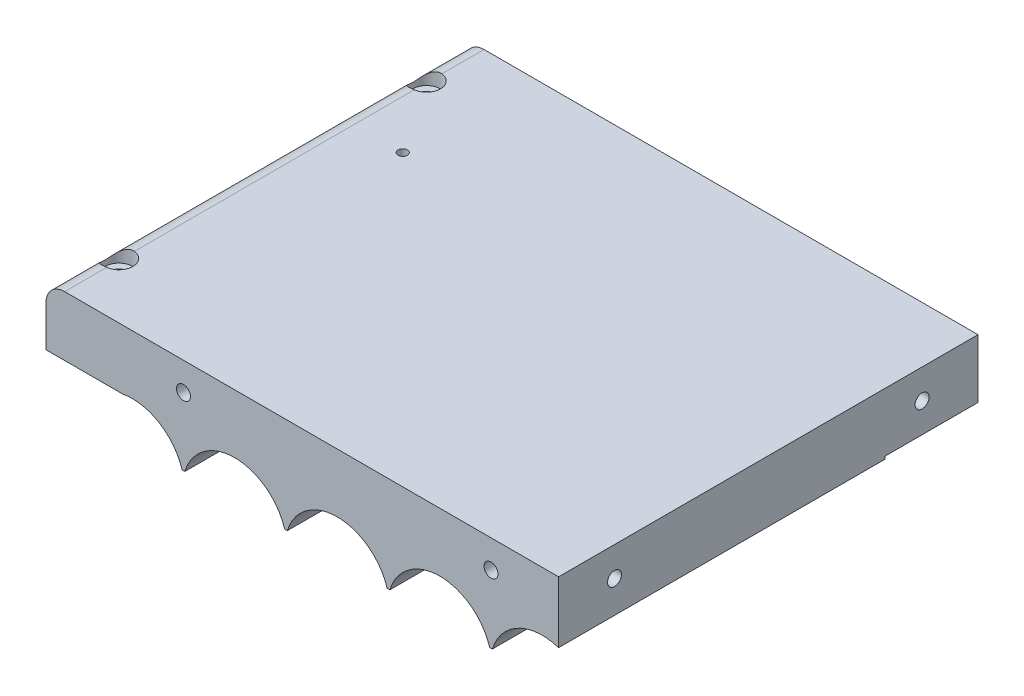
from build123d import *

# Parameters (mm, degrees)
SKETCH_1_W                      = 110
SKETCH_1_H                      = 70
EXTRUDE_1_DEPTH                 = 5
EXTRUDE_2_DEPTH                 = 70
CUT_EXTRUDE_2_DEPTH             = 70
EXTRUDE_3_DEPTH                 = 20
SKETCH_5_R                      = 1.5
CUT_EXTRUDE_3_DEPTH             = 10
SKETCH_6_R                      = 1.5
CUT_EXTRUDE_4_DEPTH             = 10
CUT_EXTRUDE_5_REACH             = 145.602
SKETCH_7_R                      = 1.5
CUT_EXTRUDE_5_DIRECTION_2_DEPTH = 144.601807274
SKETCH_8_R                      = 3
CUT_EXTRUDE_6_DEPTH             = 3
CUT_EXTRUDE_7_REACH             = 145.602
SKETCH_9_R                      = 1
FILLET_1_R                      = 4
SKETCH_10_R                     = 1.5
CUT_EXTRUDE_8_DEPTH             = 10


with BuildPart() as part:
    # 草图1 → 凸台-拉伸1 (new body)
    with BuildSketch(Plane(origin=(0, 0, 0), x_dir=(1, 0, 0), z_dir=(0, 1, 0))):
        with Locations((55, 35)):
            Rectangle(SKETCH_1_W, SKETCH_1_H)
    extrude(amount=EXTRUDE_1_DEPTH)

    # 草图2 → 凸台-拉伸2 (add)
    with BuildSketch(Plane(origin=(0, 0, -70), x_dir=(-1, 0, 0), z_dir=(0, 0, -1))):
        with BuildLine():
            Line((0, 0), (-110, 0))
            Line((-110, 0), (-110, -8.38034143))
            ThreePointArc((-110, -8.38034143), (-101.497088177, -9.012210946), (-96.000017961, -15.529955003))
            Line((-96.000017961, -15.529955003), (-94.999994392, -15.529955003))
            ThreePointArc((-94.999994392, -15.529955003), (-84.5, -7.808692226), (-74.000005608, -15.529955003))
            Line((-74.000005608, -15.529955003), (-72.999994392, -15.529955003))
            ThreePointArc((-72.999994392, -15.529955003), (-62.5, -7.808692226), (-52.000005608, -15.529955003))
            Line((-52.000005608, -15.529955003), (-50.999994392, -15.529955003))
            ThreePointArc((-50.999994392, -15.529955003), (-40.5, -7.808692226), (-30.000005608, -15.529955003))
            Line((-30.000005608, -15.529955003), (-29.000017961, -15.529955003))
            ThreePointArc((-29.000017961, -15.529955003), (-25.01669227, -9.946792076), (-18.500017961, -7.808674266))
            Line((-18.500017961, -7.808674266), (0, -7.808674266))
            Line((0, -7.808674266), (0, 0))
        make_face()
    extrude(amount=-EXTRUDE_2_DEPTH)

    # 草图3 → 切除-拉伸2 (cut)
    with BuildSketch(Plane(origin=(0, 0, -70), x_dir=(-1, 0, 0), z_dir=(0, 0, -1))):
        with BuildLine():
            Line((-96.000017961, -15.529955003), (-95.790676244, -15.529955003))
            ThreePointArc((-95.790676244, -15.529955003), (-101.348565543, -8.863698751), (-110, -8.169589449))
            Line((-110, -8.169589449), (-110, -8.38034143))
            ThreePointArc((-110, -8.38034143), (-101.497088177, -9.012210946), (-96.000017961, -15.529955003))
        make_face()
        with BuildLine():
            ThreePointArc((-73.790676244, -15.529955003), (-84.500017961, -7.608674266), (-95.209359677, -15.529955003))
            Line((-95.209359677, -15.529955003), (-94.999994392, -15.529955003))
            ThreePointArc((-94.999994392, -15.529955003), (-84.5, -7.808692226), (-74.000005608, -15.529955003))
            Line((-74.000005608, -15.529955003), (-73.790676244, -15.529955003))
        make_face()
        with BuildLine():
            ThreePointArc((-51.790676244, -15.529955003), (-62.500017961, -7.608674266), (-73.209359677, -15.529955003))
            Line((-73.209359677, -15.529955003), (-72.999994392, -15.529955003))
            ThreePointArc((-72.999994392, -15.529955003), (-62.5, -7.808692226), (-52.000005608, -15.529955003))
            Line((-52.000005608, -15.529955003), (-51.790676244, -15.529955003))
        make_face()
        with BuildLine():
            ThreePointArc((-29.790676244, -15.529955003), (-40.500017961, -7.608674266), (-51.209359677, -15.529955003))
            Line((-51.209359677, -15.529955003), (-50.999994392, -15.529955003))
            ThreePointArc((-50.999994392, -15.529955003), (-40.5, -7.808692226), (-30.000005608, -15.529955003))
            Line((-30.000005608, -15.529955003), (-29.790676244, -15.529955003))
        make_face()
        with BuildLine():
            Line((-18.500017961, -7.808674266), (-16.39288721, -7.808674266))
            ThreePointArc((-16.39288721, -7.808674266), (-24.279641861, -9.215137505), (-29.209359677, -15.529955003))
            Line((-29.209359677, -15.529955003), (-29.000017961, -15.529955003))
            ThreePointArc((-29.000017961, -15.529955003), (-25.01669227, -9.946792076), (-18.500017961, -7.808674266))
        make_face()
    extrude(amount=-CUT_EXTRUDE_2_DEPTH, mode=Mode.SUBTRACT)

    # 草图4 → 凸台-拉伸3 (add)
    with BuildSketch(Plane(origin=(0, 0, -70), x_dir=(-1, 0, 0), z_dir=(0, 0, -1))):
        Polygon((0, 5), (-110, 5), (-110, -7.608674266), (-7.3, -7.608674266), (-7.3, -7.808674266), (0, -7.808674266), (0, -7.608674266), align=None)
    extrude(amount=EXTRUDE_3_DEPTH)

    # 草图5 → 切除-拉伸3 (cut)
    with BuildSketch(Plane.XY):
        with Locations((95.50000898, -1)):
            Circle(SKETCH_5_R)
        with Locations((29.49999102, -1)):
            Circle(SKETCH_5_R)
    extrude(amount=-CUT_EXTRUDE_3_DEPTH, mode=Mode.SUBTRACT)

    # 草图6 → 切除-拉伸4 (cut)
    with BuildSketch(Plane(origin=(110, 0, 0), x_dir=(0, 0, -1), z_dir=(1, 0, 0))):
        with Locations((78, -1.304337133)):
            Circle(SKETCH_6_R)
        with Locations((12, -1.304337133)):
            Circle(SKETCH_6_R)
    extrude(amount=-CUT_EXTRUDE_4_DEPTH, mode=Mode.SUBTRACT)

    # 草图7 → 切除-拉伸5 (cut, up to next)
    with BuildSketch(Plane(origin=(0, 5, 0), x_dir=(1, 0, 0), z_dir=(0, 1, 0)), mode=Mode.PRIVATE) as cut_extrude_5_sk1:
        with Locations(Location((3.65000898, 78, 0), (0, 0, 90))):
            Circle(SKETCH_7_R)
    cut_extrude_5_tool1 = extrude(cut_extrude_5_sk1.sketch, amount=-CUT_EXTRUDE_5_REACH, mode=Mode.PRIVATE) & part.part
    # 草图7 → 切除-拉伸5 (cut, up to next)
    with BuildSketch(Plane(origin=(0, 5, 0), x_dir=(1, 0, 0), z_dir=(0, 1, 0)), mode=Mode.PRIVATE) as cut_extrude_5_sk2:
        with Locations(Location((3.65000898, 12, 0), (0, 0, 90))):
            Circle(SKETCH_7_R)
    cut_extrude_5_tool2 = extrude(cut_extrude_5_sk2.sketch, amount=-CUT_EXTRUDE_5_REACH, mode=Mode.PRIVATE) & part.part
    add(cut_extrude_5_tool1.solids().sort_by_distance((3.650009, 5, -78))[0], mode=Mode.SUBTRACT)
    add(cut_extrude_5_tool2.solids().sort_by_distance((3.650009, 5, -12))[0], mode=Mode.SUBTRACT)

    # 草图7 → 切除-拉伸5 direction 2 (cut)
    with BuildSketch(Plane(origin=(0, 5, 0), x_dir=(1, 0, 0), z_dir=(0, 1, 0))):
        with Locations(Location((3.65000898, 78, 0), (0, 0, 90))):
            Circle(SKETCH_7_R)
        with Locations(Location((3.65000898, 12, 0), (0, 0, 90))):
            Circle(SKETCH_7_R)
    extrude(amount=CUT_EXTRUDE_5_DIRECTION_2_DEPTH, mode=Mode.SUBTRACT)

    # 草图8 → 切除-拉伸6 (cut)
    with BuildSketch(Plane(origin=(0, 5, 0), x_dir=(1, 0, 0), z_dir=(0, 1, 0))):
        with Locations(Location((3.65000898, 12, 0), (0, 0, 270))):
            Circle(SKETCH_8_R)
        with Locations(Location((3.65000898, 78, 0), (0, 0, 270))):
            Circle(SKETCH_8_R)
    extrude(amount=-CUT_EXTRUDE_6_DEPTH, mode=Mode.SUBTRACT)

    # 草图9 → 切除-拉伸7 (cut, up to next)
    with BuildSketch(Plane(origin=(0, 5, 0), x_dir=(1, 0, 0), z_dir=(0, 1, 0)), mode=Mode.PRIVATE) as cut_extrude_7_sk1:
        with Locations(Location((14.442, 62.109, 0), (0, 0, 270))):
            Circle(SKETCH_9_R)
    cut_extrude_7_tool1 = extrude(cut_extrude_7_sk1.sketch, amount=-CUT_EXTRUDE_7_REACH, mode=Mode.PRIVATE) & part.part
    add(cut_extrude_7_tool1.solids().sort_by_distance((14.442, 5, -62.109))[0], mode=Mode.SUBTRACT)

    # 圆角1
    # the kernel refuses this fillet: 4 mm, written as the material it takes off along each edge
    with BuildSketch(Plane(origin=(0, 5, 10), x_dir=(0, -1, 0), z_dir=(0, 0, -1))) as fillet_1_piece_1:
        with BuildLine():
            CenterArc((FILLET_1_R, -FILLET_1_R), FILLET_1_R, 90, 90)
            Line((0, -FILLET_1_R), (0, 0))
            Line((0, 0), (FILLET_1_R, 0))
        make_face()
    extrude(amount=110, mode=Mode.SUBTRACT)

    # 草图10 → 切除-拉伸8 (cut)
    with BuildSketch(Plane(origin=(0, 0, -90), x_dir=(-1, 0, 0), z_dir=(0, 0, -1))):
        with Locations((-62.5, -1.304337133)):
            Circle(SKETCH_10_R)
    extrude(amount=-CUT_EXTRUDE_8_DEPTH, mode=Mode.SUBTRACT)


solid = part.part
